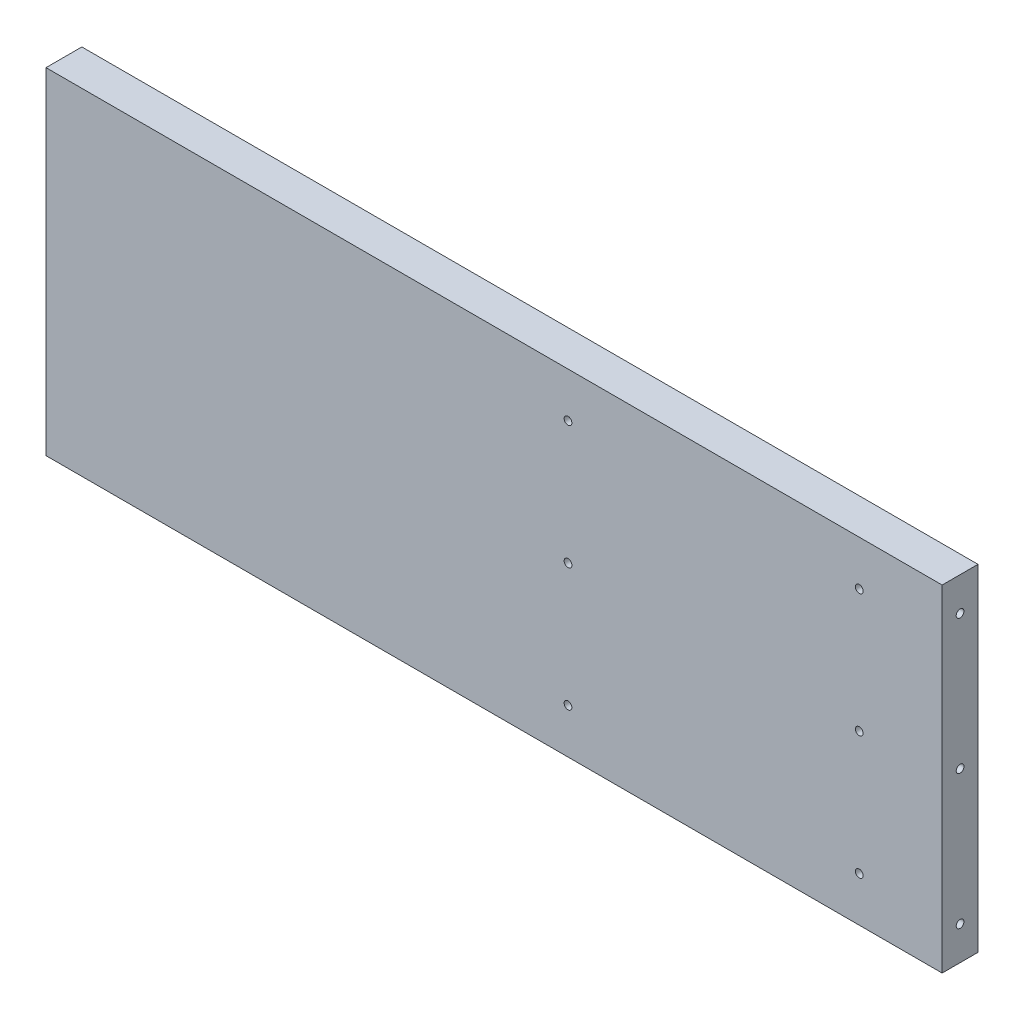
from build123d import *

# Parameters (mm, degrees)
SKETCH1_W                      = 400
SKETCH1_H                      = 150
BOSS_EXTRUDE1_DEPTH            = 8
F_8_36_START                   = -8
F_8_36_TAPPED_HOLE1_OUTLINE_R  = 1.7272
F_8_36_TAPPED_HOLE1_DEPTH      = 16
F_8_36_TAPPED_HOLE2_D          = 3.4544
F_8_36_TAPPED_HOLE2_DEPTH      = 25
F_8_36_TAPPED_HOLE2_TIP        = 1.037806461
F_8_36_TAPPED_HOLE3_AT_2_COUNT = 2
F_8_36_TAPPED_HOLE3_AT_2_PITCH = 24
LPATTERN1_COUNT                = 2
LPATTERN1_PITCH                = 200


# Read off the part's stored shape, not the designer's step: #8-36 Tapped Hole1
with BuildPart() as part:
    # Sketch1 → Boss-Extrude1 (new, symmetric)
    with BuildSketch(Plane.XY):
        Rectangle(SKETCH1_W, SKETCH1_H)
    extrude(amount=BOSS_EXTRUDE1_DEPTH, both=True)

    # #8-36 Tapped Hole1 outline → #8-36 Tapped Hole1 (cut)
    with BuildSketch(Plane.XY.offset(F_8_36_START)):
        with Locations((33, 0)):
            Circle(F_8_36_TAPPED_HOLE1_OUTLINE_R)
        with Locations((163, 0)):
            Circle(F_8_36_TAPPED_HOLE1_OUTLINE_R)
        with Locations((163, -55)):
            Circle(F_8_36_TAPPED_HOLE1_OUTLINE_R)
        with Locations((33, 55)):
            Circle(F_8_36_TAPPED_HOLE1_OUTLINE_R)
        with Locations((163, 55)):
            Circle(F_8_36_TAPPED_HOLE1_OUTLINE_R)
        with Locations((33, -55)):
            Circle(F_8_36_TAPPED_HOLE1_OUTLINE_R)
    extrude(amount=F_8_36_TAPPED_HOLE1_DEPTH, mode=Mode.SUBTRACT)

    # #8-36 Tapped Hole2
    with Locations(Plane(origin=(200, -75, -313), x_dir=(0, 0, -1), z_dir=(1, 0, 0))):
        with Locations((-313, 135), (-313, 75), (-313, 15)):
            Hole(F_8_36_TAPPED_HOLE2_D / 2, depth=F_8_36_TAPPED_HOLE2_DEPTH)
            with Locations((0, 0, -(F_8_36_TAPPED_HOLE2_DEPTH + F_8_36_TAPPED_HOLE2_TIP / 2))):  # 118° drill point
                Cone(0, F_8_36_TAPPED_HOLE2_D / 2, F_8_36_TAPPED_HOLE2_TIP, mode=Mode.SUBTRACT)

    # Sketch7 → #8-36 Tapped Hole3 (revolve, cut)
    with BuildSketch(Plane(origin=(-88, -75, 0), x_dir=(0, 0, -1), z_dir=(1, 0, 0))):
        Polygon((0, 0), (0, 26.037806461), (1.7272, 25), (1.7272, 0), align=None)
    f_8_36_tapped_hole3 = revolve(axis=Axis((-88, -81.35, 0), (0, 1, 0)), mode=Mode.SUBTRACT)

    # #8-36 Tapped Hole3 at 2: #8-36 Tapped Hole3 ×2
    with Locations(*[(-i * F_8_36_TAPPED_HOLE3_AT_2_PITCH, 0, 0) for i in range(1, F_8_36_TAPPED_HOLE3_AT_2_COUNT)]):
        add(f_8_36_tapped_hole3, mode=Mode.SUBTRACT)

    # LPattern1: #8-36 Tapped Hole3 ×2
    with Locations(*[(i * LPATTERN1_PITCH, 0, 0) for i in range(1, LPATTERN1_COUNT)]):
        add(f_8_36_tapped_hole3, mode=Mode.SUBTRACT)

    # LPattern1 copy 1 sketch → LPattern1 copy 1 (revolve, cut)
    with BuildSketch(Plane(origin=(88, -75, 0), x_dir=(0, 0, -1), z_dir=(1, 0, 0))):
        Polygon((0, 0), (0, 26.037806461), (1.7272, 25), (1.7272, 0), align=None)
    revolve(axis=Axis((88, -81.35, 0), (0, 1, 0)), mode=Mode.SUBTRACT)


solid = part.part
